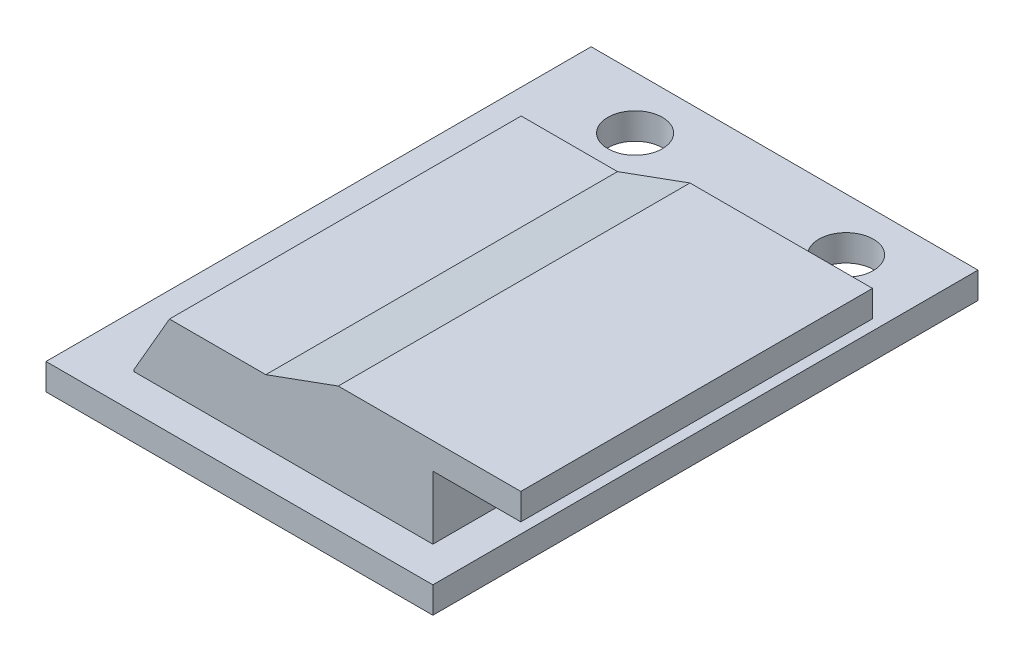
from build123d import *

# Parameters (mm, degrees)
SKIZZE2_W                        = 17
SKIZZE2_H                        = 20
AUFSATZ_LINEAR_AUSTRAGEN1_DEPTH  = 3.6
SKIZZE3_W                        = 22
SKIZZE3_H                        = 31
AUFSATZ_LINEAR_AUSTRAGEN2_DEPTH  = 1.5
F_3_1_3_1_DURCHMESSER_BOHRUNG1_D = 3.1
SKIZZE10_W                       = 10
SKIZZE10_H                       = 20
AUFSATZ_LINEAR_AUSTRAGEN3_DEPTH  = 1.5
FASE4_SIZE                       = 4.5
FASE4_SIZE_2                     = 1.637866054
FASE5_SIZE                       = 3.5
FASE5_SIZE2                      = 2.020725942


with BuildPart() as part:
    # Skizze2 → Aufsatz-Linear austragen1 (new body)
    with BuildSketch(Plane(origin=(0, 0, 0), x_dir=(1, 0, 0), z_dir=(0, 1, 0))):
        Rectangle(SKIZZE2_W, SKIZZE2_H)
    extrude(amount=AUFSATZ_LINEAR_AUSTRAGEN1_DEPTH)

    # Skizze3 → Aufsatz-Linear austragen2 (add)
    with BuildSketch(Plane(origin=(0, 0, 0), x_dir=(-1, 0, 0), z_dir=(0, -1, 0))):
        with Locations((0.5, 3.5)):
            Rectangle(SKIZZE3_W, SKIZZE3_H)
    extrude(amount=AUFSATZ_LINEAR_AUSTRAGEN2_DEPTH)

    # Ø3.1 (3.1) Durchmesser Bohrung1 (through all)
    with Locations(Plane(origin=(0, -1.5, 0), x_dir=(-1, 0, 0), z_dir=(0, -1, 0))):
        with Locations((6, 16), (-6, 16)):
            Hole(F_3_1_3_1_DURCHMESSER_BOHRUNG1_D / 2)

    # Skizze10 → Aufsatz-Linear austragen3 (add)
    with BuildSketch(Plane(origin=(0, 3.6, 0), x_dir=(1, 0, 0), z_dir=(0, 1, 0))):
        with Locations((8.5, 0)):
            Rectangle(SKIZZE10_W, SKIZZE10_H)
    extrude(amount=AUFSATZ_LINEAR_AUSTRAGEN3_DEPTH)

    # Fase4
    # the kernel refuses this chamfer: 4.5, 1.637866054 mm, written as the material it adds along each edge
    with BuildSketch(Plane(origin=(3.5, 3.6, -10), x_dir=(-0.9999130865277315, -0.01318405819864591, 0), z_dir=(0, 0, 1))) as fase4_piece_1_section:
        Polygon((FASE4_SIZE * 0.999913086528, -FASE4_SIZE * 0.0131840581986), (-FASE4_SIZE_2 * 0.0131840582002, -FASE4_SIZE_2 * 0.999913086649), (0, 0), align=None)
    fase4_piece_1 = extrude(amount=20, mode=Mode.PRIVATE)
    fase4_piece_1 = split(fase4_piece_1, bisect_by=Plane(origin=(1.935786974, 5.1, 0), z_dir=(0, -1, 0)), keep=Keep.TOP, mode=Mode.PRIVATE)
    add(fase4_piece_1)

    # Fase5
    fase5_edges = [part.edges().sort_by_distance(p)[0] for p in [
        (-8.5, 3.6, 0),
    ]]
    fase5_side = [part.faces().sort_by_distance(p)[0] for p in [
        (-8.5, 1.8, 0),
    ]]
    chamfer(fase5_edges, length=FASE5_SIZE, length2=FASE5_SIZE2, reference=fase5_side[0])


solid = part.part
